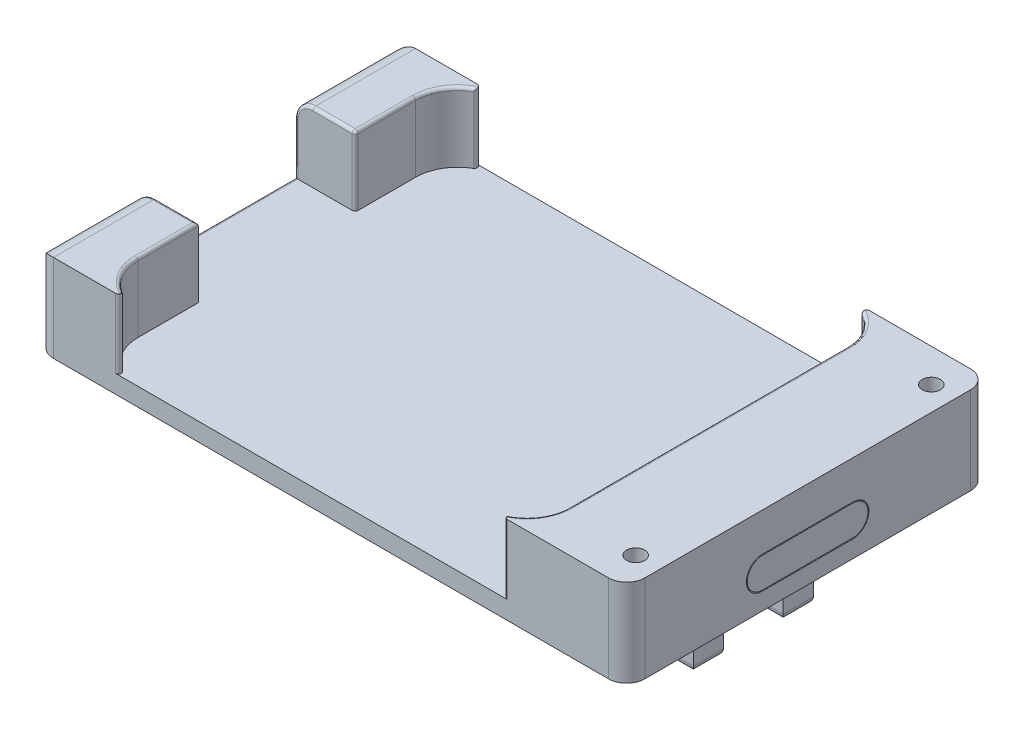
from build123d import *

# Parameters (mm, degrees)
SKETCH1_W           = 13.75
SKETCH1_H           = 49
SKETCH1_W_2         = 16.25
BOSS_EXTRUDE1_DEPTH = 3
SKETCH8_W           = 16
SKETCH8_H           = 5
SKETCH8_W_2         = 12
SKETCH8_H_2         = 9.95
BOSS_EXTRUDE4_DEPTH = 12.2
SKETCH10_R          = 1.5
BOSS_EXTRUDE5_DEPTH = 11.5
SKETCH10_3_R        = 1.5
BOSS_EXTRUDE6_DEPTH = 8.5
BOSS_EXTRUDE8_DEPTH = 11.5
FILLET1_R           = 3
FILLET4_START       = -30
FILLET4_DEPTH       = 60
FILLET6_R           = 1
CUT_EXTRUDE1_DEPTH  = 20
FILLET7_R           = 0.5


with BuildPart() as part:
    # Sketch1 → Boss-Extrude1 (new body)
    with BuildSketch(Plane(origin=(2.725879216, 0, 0), x_dir=(0, 0, -1), z_dir=(0, -1, 0))):
        with Locations((-23.125, 21.774120784)):
            Rectangle(SKETCH1_W, SKETCH1_H)
        with Locations((-23.125, -27.225879216)):
            Rectangle(SKETCH1_W, SKETCH1_H)
        with Locations((-9.375, 21.774120784)):
            Rectangle(SKETCH1_W, SKETCH1_H)
        with Locations((-9.375, -27.225879216)):
            Rectangle(SKETCH1_W, SKETCH1_H)
        with Locations((5.625, 21.774120784)):
            Rectangle(SKETCH1_W_2, SKETCH1_H)
        with Locations((5.625, -27.225879216)):
            Rectangle(SKETCH1_W_2, SKETCH1_H)
        with Locations((21.875, 21.774120784)):
            Rectangle(SKETCH1_W_2, SKETCH1_H)
        with Locations((21.875, -27.225879216)):
            Rectangle(SKETCH1_W_2, SKETCH1_H)
    extrude(amount=BOSS_EXTRUDE1_DEPTH)

    # Sketch8 → Boss-Extrude4 (add)
    with BuildSketch(Plane(origin=(0, -3, -2), x_dir=(-1, 0, 0), z_dir=(0, 1, 0))):
        with Locations((-32, 9.45)):
            Rectangle(SKETCH8_W, SKETCH8_H)
        with Locations((-32, -5.45)):
            Rectangle(SKETCH8_W, SKETCH8_H)
        with Locations((6, -2.975)):
            Rectangle(SKETCH8_W_2, SKETCH8_H_2)
        with Locations((-6, -2.975)):
            Rectangle(SKETCH8_W_2, SKETCH8_H_2)
        with Locations((-6, 6.975)):
            Rectangle(SKETCH8_W_2, SKETCH8_H_2)
        with Locations((6, 6.975)):
            Rectangle(SKETCH8_W_2, SKETCH8_H_2)
        with Locations((32, -5.45)):
            Rectangle(SKETCH8_W, SKETCH8_H)
        with Locations((32, 9.45)):
            Rectangle(SKETCH8_W, SKETCH8_H)
    extrude(amount=-BOSS_EXTRUDE4_DEPTH)

    # Sketch10 → Boss-Extrude5 (add)
    with BuildSketch(Plane(origin=(0, 0, 0), x_dir=(1, 0, 0), z_dir=(0, 1, 0))):
        with BuildLine():
            Line((49, 30), (25.5, 30))
            ThreePointArc((25.5, 30), (30.449747468, 27.949747468), (32.5, 23))
            Line((32.5, 23), (32.5, -23))
            ThreePointArc((32.5, -23), (30.449747483, -27.949747453), (25.500000042, -30))
            Line((25.500000042, -30), (49, -30))
            Line((49, -30), (49, 30))
        make_face()
        with Locations(Location((45, 24.5, 0), (0, 0, 270))):
            Circle(SKETCH10_R, mode=Mode.SUBTRACT)
        with Locations(Location((45, -24.5, 0), (0, 0, 270))):
            Circle(SKETCH10_R, mode=Mode.SUBTRACT)
    extrude(amount=BOSS_EXTRUDE5_DEPTH)

    # Sketch10<3> → Boss-Extrude6 (add)
    with BuildSketch(Plane(origin=(0, 0, 0), x_dir=(1, 0, 0), z_dir=(0, 1, 0))):
        with Locations(Location((45, 24.5, 0), (0, 0, 270))):
            Circle(SKETCH10_3_R)
        with Locations(Location((45, -24.5, 0), (0, 0, 270))):
            Circle(SKETCH10_3_R)
    extrude(amount=BOSS_EXTRUDE6_DEPTH)

    # Sketch14 → Boss-Extrude8 (add)
    with BuildSketch(Plane(origin=(0, 0, 0), x_dir=(1, 0, 0), z_dir=(0, 1, 0))):
        with BuildLine():
            Line((-49, 30), (-49, 13))
            Line((-49, 13), (-39, 13))
            Line((-39, 13), (-39, 23))
            ThreePointArc((-39, 23), (-36.949747468, 27.949747468), (-32, 30))
            Line((-32, 30), (-49, 30))
        make_face()
        with BuildLine():
            Line((-39, -13), (-49, -13))
            Line((-49, -13), (-49, -30))
            Line((-49, -30), (-32, -30))
            ThreePointArc((-32, -30), (-36.949747468, -27.949747468), (-39, -23))
            Line((-39, -23), (-39, -13))
        make_face()
    extrude(amount=BOSS_EXTRUDE8_DEPTH)

    # Fillet1
    fillet1_edges = [part.edges().sort_by_distance(p)[0] for p in [
        (49, 4.25, -30),
        (49, 4.25, 30),
        (-49, 4.25, 30),
        (-49, 4.25, -30),
        (-49, 11.5, -21.5),
        (-49, 11.5, 21.5),
    ]]
    fillet(fillet1_edges, radius=FILLET1_R)

    # Fillet4: read off the stored shape, not the designer's step
    # Fillet4 outline → Fillet4 (add)
    with BuildSketch(Plane.XY.offset(FILLET4_START)):
        with BuildLine():
            Line((32.5, 0), (32.5, 3))
            add(Edge.make_bspline(
                [(32.5, 3), (32.5, 0), (29.5, 0)],
                knots=[0, 0, 0, 1, 1, 1], degree=2, weights=[1, 0.707106781, 1]))
            Line((29.5, 0), (32.5, 0))
        make_face()
    extrude(amount=FILLET4_DEPTH)

    # Fillet6
    fillet6_edges = [part.edges().sort_by_distance(p)[0] for p in [
        (32, -15.2, 9.95),
        (32, -15.2, 4.95),
        (40, -15.2, 7.45),
        (32, -15.2, -4.95),
        (32, -15.2, -9.95),
        (40, -15.2, -7.45),
        (0, -15.2, 9.95),
        (0, -15.2, -9.95),
        (-32, -15.2, -9.95),
        (-32, -15.2, -4.95),
        (-40, -15.2, -7.45),
        (-32, -15.2, 4.95),
        (-32, -15.2, 9.95),
        (-40, -15.2, 7.45),
    ]]
    fillet(fillet6_edges, radius=FILLET6_R)

    # Sketch16 → Cut-Extrude1 (cut)
    with BuildSketch(Plane(origin=(49, 0, 0), x_dir=(0, 0, -1), z_dir=(1, 0, 0))):
        with BuildLine():
            Line((-7.5, 5.15), (7.5, 5.15))
            ThreePointArc((7.5, 5.15), (10.15, 2.5), (7.5, -0.15))
            Line((7.5, -0.15), (-7.5, -0.15))
            ThreePointArc((-7.5, -0.15), (-10.15, 2.5), (-7.5, 5.15))
        make_face()
        with BuildLine():
            Line((-7.5, 5), (7.5, 5))
            ThreePointArc((7.5, 5), (10, 2.5), (7.5, 0))
            Line((7.5, 0), (-7.5, 0))
            ThreePointArc((-7.5, 0), (-10, 2.5), (-7.5, 5))
        make_face(mode=Mode.SUBTRACT)
    extrude(amount=-CUT_EXTRUDE1_DEPTH, mode=Mode.SUBTRACT)


with BuildPart() as cut_extrude1_piece_1:
    # of the separate pieces the step leaves, piece 1, a body of its own (cut_extrude1_pieces)
    add(part.part.solids().sort_by_distance((-24, -14.2, 9.95))[0])

    # Fillet7
    fillet7_edges = [cut_extrude1_piece_1.edges().sort_by_distance(p)[0] for p in [
        (-36.949747468, 11.5, 27.949747468),
        (-32, 5.75, 30),
        (-42.5, 11.5, 13),
        (-48.121320344, 10.621320344, 13),
        (-36.949747468, 11.5, -27.949747468),
        (-39, 11.5, 18),
        (30.449747468, 11.5, -27.949747468),
        (30.449747483, 11.5, 27.949747453),
        (-42.5, 11.5, -13),
        (-48.121320344, 10.621320344, -13),
        (-49, 4.25, 13),
        (-49, 0, 0),
        (-39, 11.5, -18),
        (32.5, 11.5, 0),
        (25.500000042, 5.75, 30),
        (25.5, 5.75, -30),
        (-32, 5.75, -30),
        (-39, 5.75, -13),
        (-49, 4.25, -13),
    ]]
    fillet(fillet7_edges, radius=FILLET7_R)


with BuildPart() as cut_extrude1_piece_2:
    # of the separate pieces the step leaves, piece 2, a body of its own (cut_extrude1_pieces)
    add(part.part.solids().sort_by_distance((49, 0, -7.5))[0])


solid = Compound([cut_extrude1_piece_1.part, cut_extrude1_piece_2.part])
